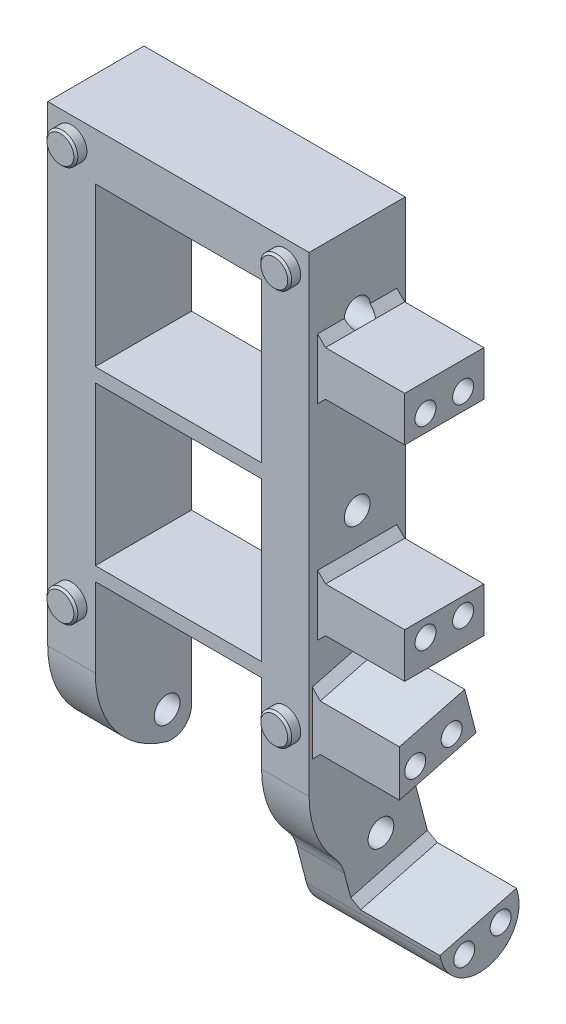
from build123d import *

# Parameters (mm, degrees)
SKETCH2_W               = 42
SKETCH2_H               = 40
BOSS_EXTRUDE1_DEPTH     = 12.15
CUT_EXTRUDE1_DEPTH      = 149.231651478
CUT_EXTRUDE1_DEPTH_BACK = 149.231651478
SKETCH3_R               = 3.25
FILLET1_R               = 25
FILLET2_R               = 5
SKETCH4_R               = 3.9
BOSS_EXTRUDE2_DEPTH     = 2.8
CHAMFER1_SIZE           = 0.5
SKETCH6_W               = 20
SKETCH6_H               = 11.3
BOSS_EXTRUDE3_DEPTH     = 22
BOSS_EXTRUDE5_DEPTH     = 12
SKETCH7_R               = 2.65
CUT_EXTRUDE2_DEPTH      = 10
FILLET3_R               = 10
CHAMFER3_SIZE           = 2
SKETCH9_R               = 3.25
CUT_EXTRUDE3_DEPTH      = 2


# Some blends are built 0.0001 mm under size
with BuildPart() as part:
    # Sketch2 → Boss-Extrude1 (new, symmetric)
    with BuildSketch(Plane.XY):
        Polygon((-33, 0), (33, 0), (33, -144), (21, -144), (21, -99), (-21, -99), (-21, -144), (-33, -144), align=None)
        with Locations((0, -32)):
            Rectangle(SKETCH2_W, SKETCH2_H, mode=Mode.SUBTRACT)
        with Locations((0, -75.5)):
            Rectangle(SKETCH2_W, SKETCH2_H, mode=Mode.SUBTRACT)
    extrude(amount=BOSS_EXTRUDE1_DEPTH, both=True)

    # Sketch3 → Cut-Extrude1 (cut, two sides: drawn at the far end of the back side and taken through both)
    with BuildSketch(Plane(origin=(0, 0, 0), x_dir=(0, 0, -1), z_dir=(1, 0, 0)).offset(-CUT_EXTRUDE1_DEPTH_BACK)):
        with Locations((0, -106)):
            Circle(SKETCH3_R)
        with Locations((0, -62.5)):
            Circle(SKETCH3_R)
        with Locations((0, -19)):
            Circle(SKETCH3_R)
        with Locations((6, -136)):
            Circle(SKETCH3_R)
    extrude(amount=CUT_EXTRUDE1_DEPTH + CUT_EXTRUDE1_DEPTH_BACK, mode=Mode.SUBTRACT)

    # Fillet1
    # the kernel refuses this fillet: 25 mm, written as the material it takes off along each edge
    with BuildSketch(Plane(origin=(95.475495196, -144, 12.15), x_dir=(0, 1, 0), z_dir=(-1, 0, 0)), Plane(origin=(41.475495196, -144, 12.15), x_dir=(0, 1, 0), z_dir=(-1, 0, 0))) as fillet1_piece_1:
        with BuildLine():
            CenterArc((24.990198078, 25), FILLET1_R, 181.604491527, 88.395508473)
            Line((0, 24.3), (-0.499803962, 24.286))
            ThreePointArc((-0.499803962, 24.286), (-0.5, 12.15), (-0.5, 0))
            Line((-0.5, 0), (0, -0.5))
            Line((0, -0.5), (24.990198078, -0.5))
            Line((24.990198078, -0.5), (24.990198078, 0))
        make_face()
    extrude(amount=136.950990392, mode=Mode.SUBTRACT)

    # Fillet2
    fillet2_edges = [part.edges().sort_by_distance(p)[0] for p in [
        (-27, -144, -12.15),
        (27, -144, -12.15),
    ]]
    fillet(fillet2_edges, radius=FILLET2_R)

    # Sketch4 → Boss-Extrude2 (add)
    with BuildSketch(Plane(origin=(0, 0, 12.15), x_dir=(-1, 0, 0), z_dir=(0, 0, -1))):
        with Locations((-27, -6)):
            Circle(SKETCH4_R)
        with Locations((27, -6)):
            Circle(SKETCH4_R)
        with Locations((27, -106)):
            Circle(SKETCH4_R)
        with Locations((-27, -106)):
            Circle(SKETCH4_R)
    extrude(amount=-BOSS_EXTRUDE2_DEPTH)

    # Chamfer1
    chamfer1_edges = [part.edges().sort_by_distance(p)[0] for p in [
        (30.9, -6, 14.95),
        (-23.1, -6, 14.95),
        (-23.1, -106, 14.95),
        (30.9, -106, 14.95),
    ]]
    chamfer(chamfer1_edges, length=CHAMFER1_SIZE)

    # Sketch6 → Boss-Extrude3 (add)
    with BuildSketch(Plane(origin=(55, 0, 0), x_dir=(0, 0, -1), z_dir=(1, 0, 0))):
        with Locations((0, -26.54)):
            Rectangle(SKETCH6_W, SKETCH6_H)
        with Locations((0, -78.24)):
            Rectangle(SKETCH6_W, SKETCH6_H)
        Polygon((-1.125133679, -148.289856389), (18.225525462, -143.234958685), (21.081542665, -154.168081099), (1.730883524, -159.222978804), align=None)
        Polygon((-11.336027041, -97.522336202), (5.158614897, -93.213504805), (8.0146321, -104.146627219), (-11.336027041, -109.201524924), align=None)
    extrude(amount=-BOSS_EXTRUDE3_DEPTH)


with BuildPart() as boss_extrude3_piece_1:
    # of the separate pieces the step leaves, piece 1, a body of its own (boss_extrude3_pieces)
    add(part.part.solids().sort_by_distance((23.1, -106, 14.45))[0])



with BuildPart() as boss_extrude3_piece_2:
    # of the separate pieces the step leaves, piece 2, a body of its own (boss_extrude3_pieces)
    add(part.part.solids().sort_by_distance((55, -148.289856389, 1.125133679))[0])


with BuildPart() as boss_extrude3_piece_1_1:
    add(boss_extrude3_piece_1.part)

    add(boss_extrude3_piece_2.part)  # Boss-Extrude5 merges Boss-Extrude3 piece 2
    # Sketch8 → Boss-Extrude5 (add)
    with BuildSketch(Plane(origin=(33, 0, 0), x_dir=(0, 0, -1), z_dir=(1, 0, 0))):
        with BuildLine():
            Line((-1.125133679, -148.289856389), (-3.933707562, -137.538351797))
            ThreePointArc((-3.933707562, -137.538351797), (0.590701612, -140.797633457), (5.725, -142.972989836))
            ThreePointArc((5.725, -142.972989836), (10.139565186, -142.188157138), (12.15, -138.180352253))
            Line((12.15, -138.180352253), (12.15, -119.977233364))
            Line((12.15, -119.977233364), (18.225525462, -143.234958685))
            Line((18.225525462, -143.234958685), (21.081542665, -154.168081099))
            Line((21.081542665, -154.168081099), (1.730883524, -159.222978804))
            Line((1.730883524, -159.222978804), (-1.125133679, -148.289856389))
        make_face()
    extrude(amount=-BOSS_EXTRUDE5_DEPTH)

    # Sketch7 → Cut-Extrude2 (cut)
    with BuildSketch(Plane(origin=(55, 0, 0), x_dir=(0, 0, -1), z_dir=(1, 0, 0))):
        with Locations((-4.75, -27.89)):
            Circle(SKETCH7_R)
        with Locations((4.75, -27.89)):
            Circle(SKETCH7_R)
        with Locations((-4.75, -76.89)):
            Circle(SKETCH7_R)
        with Locations((4.75, -76.89)):
            Circle(SKETCH7_R)
        with Locations((-7.343282023, -103.714222561)):
            Circle(SKETCH7_R)
        with Locations((1.848281069, -101.313146151)):
            Circle(SKETCH7_R)
        with Locations((5.041217352, -151.123337457)):
            Circle(SKETCH7_R)
        with Locations((14.232780444, -148.722261047)):
            Circle(SKETCH7_R)
    extrude(amount=-CUT_EXTRUDE2_DEPTH, mode=Mode.SUBTRACT)

    # Fillet3
    fillet3_edges = [boss_extrude3_piece_1_1.edges().sort_by_distance(p)[0] for p in [
        (38, -159.222978804, -1.730883524),
        (38, -154.168081099, -21.081542665),
        (27, -119.977233364, -12.15),
        (27, -137.538351797, 3.933707562),
    ]]
    fillet(fillet3_edges, radius=FILLET3_R - 0.0001)  # a hair under: the kernel refuses the full size

    # Chamfer3
    # the kernel refuses this chamfer: 2 mm, written as the material it adds along each edge
    with BuildSketch(Plane(origin=(33, -20.89, 2.499429517), x_dir=(-0.027495876610585647, 0.9996219169112968, 0), z_dir=(0, 0, -1))) as chamfer3_piece_1_section:
        Polygon((CHAMFER3_SIZE * 0.999621916911, CHAMFER3_SIZE * 0.0274958766106), (-CHAMFER3_SIZE * 0.0274958766106, CHAMFER3_SIZE * 0.999621916911), (0, 0), align=None)
    chamfer3_piece_1 = extrude(amount=12.499429517, mode=Mode.PRIVATE)
    chamfer3_piece_1 = chamfer3_piece_1 - Plane(origin=(33.672455273, -19, 0), x_dir=(0, 0, -1), z_dir=(-1, 0, 0)) * Cylinder(3.25, 33, mode=Mode.PRIVATE)
    add(chamfer3_piece_1)
    with BuildSketch(Plane(origin=(33, -20.89, 10), x_dir=(-0.027495876610585647, 0.9996219169112968, 0), z_dir=(0, 0, -1))) as chamfer3_piece_2_section:
        Polygon((CHAMFER3_SIZE * 0.999621916911, CHAMFER3_SIZE * 0.0274958766106), (-CHAMFER3_SIZE * 0.0274958766106, CHAMFER3_SIZE * 0.999621916911), (0, 0), align=None)
    chamfer3_piece_2 = extrude(amount=12.499429517, mode=Mode.PRIVATE)
    chamfer3_piece_2 = chamfer3_piece_2 - Plane(origin=(33.672455268, -19, 0), x_dir=(0, 0, -1), z_dir=(-1, 0, 0)) * Cylinder(3.25, 33, mode=Mode.PRIVATE)
    add(chamfer3_piece_2)
    with BuildSketch(Plane(origin=(33, -32.19, -10), x_dir=(-0.027495876610585647, -0.9996219169112968, 0), z_dir=(0, 0, 1)), Plane(origin=(33, -72.59, 10), x_dir=(-0.02749587661058555, 0.9996219169112968, 0), z_dir=(0, 0, -1)), Plane(origin=(33, -83.89, -10), x_dir=(-0.02749587661058555, -0.9996219169112968, 0), z_dir=(0, 0, 1)), Plane(origin=(33, -148.289856389, 1.125133679), x_dir=(-0.02749587661058553, 0.967167149212802, 0.2526493266426751), z_dir=(0, 0.25274488520952904, -0.96753295706163))) as chamfer3_piece_3:
        Polygon((CHAMFER3_SIZE * 0.999621916911, CHAMFER3_SIZE * 0.0274958766106), (-CHAMFER3_SIZE * 0.0274958766106, CHAMFER3_SIZE * 0.999621916911), (0, 0), align=None)
    extrude(amount=20)
    with BuildSketch(Plane(origin=(33, -105.744268383, -1.898700305), x_dir=(-0.0274958766105857, -0.9671671492128014, -0.25264932664267675), z_dir=(0, -0.25274488520953076, 0.9675329570616297))) as chamfer3_piece_4_section:
        Polygon((CHAMFER3_SIZE * 0.999621916911, CHAMFER3_SIZE * 0.0274958766106), (-CHAMFER3_SIZE * 0.0274958766106, CHAMFER3_SIZE * 0.999621916911), (0, 0), align=None)
    chamfer3_piece_4 = extrude(amount=18.822204769, mode=Mode.PRIVATE)
    chamfer3_piece_4 = chamfer3_piece_4 - Plane(origin=(33.659062182, -106, 0), x_dir=(0, 0, -1), z_dir=(-1, 0, 0)) * Cylinder(3.25, 46, mode=Mode.PRIVATE)
    chamfer3_piece_4 = split(chamfer3_piece_4, bisect_by=Plane(origin=(33.659062182, -108.784347248, 11.336027041), z_dir=(0, 0, -1)), keep=Keep.TOP, mode=Mode.PRIVATE)
    add(chamfer3_piece_4)
    with BuildSketch(Plane(origin=(33, -98.822295645, 16.312403133), x_dir=(-0.027495876610585716, 0.9671671492128022, 0.25264932664267414), z_dir=(0, 0.25274488520952815, -0.9675329570616303))) as chamfer3_piece_5_section:
        Polygon((CHAMFER3_SIZE * 0.999621916911, CHAMFER3_SIZE * 0.0274958766106), (-CHAMFER3_SIZE * 0.0274958766106, CHAMFER3_SIZE * 0.999621916911), (0, 0), align=None)
    chamfer3_piece_5 = extrude(amount=22.191510763, mode=Mode.PRIVATE)
    chamfer3_piece_5 = split(chamfer3_piece_5, bisect_by=Plane(origin=(33.668386777, -94.70433277, 11.336027041), z_dir=(0, 0, -1)), keep=Keep.TOP, mode=Mode.PRIVATE)
    add(chamfer3_piece_5)
    with BuildSketch(Plane(origin=(33, -104.146627219, -8.0146321), x_dir=(-0.027495876610585706, -0.9671671492128016, -0.25264932664267675), z_dir=(0, -0.25274488520953076, 0.9675329570616297))) as chamfer3_piece_6_section:
        Polygon((CHAMFER3_SIZE * 0.999621916911, CHAMFER3_SIZE * 0.0274958766106), (-CHAMFER3_SIZE * 0.0274958766106, CHAMFER3_SIZE * 0.999621916911), (0, 0), align=None)
    chamfer3_piece_6 = extrude(amount=10.124541165, mode=Mode.PRIVATE)
    chamfer3_piece_6 = chamfer3_piece_6 - Plane(origin=(33.659192964, -106, 0), x_dir=(0, 0, -1), z_dir=(-1, 0, 0)) * Cylinder(3.25, 29, mode=Mode.PRIVATE)
    add(chamfer3_piece_6)

    # Sketch9 → Cut-Extrude3 (cut)
    with BuildSketch(Plane(origin=(33, 0, 0), x_dir=(0, 0, -1), z_dir=(1, 0, 0))):
        with Locations((0, -19)):
            Circle(SKETCH9_R)
        with Locations((0, -106)):
            Circle(SKETCH9_R)
    extrude(amount=CUT_EXTRUDE3_DEPTH, mode=Mode.SUBTRACT)


solid = boss_extrude3_piece_1_1.part
